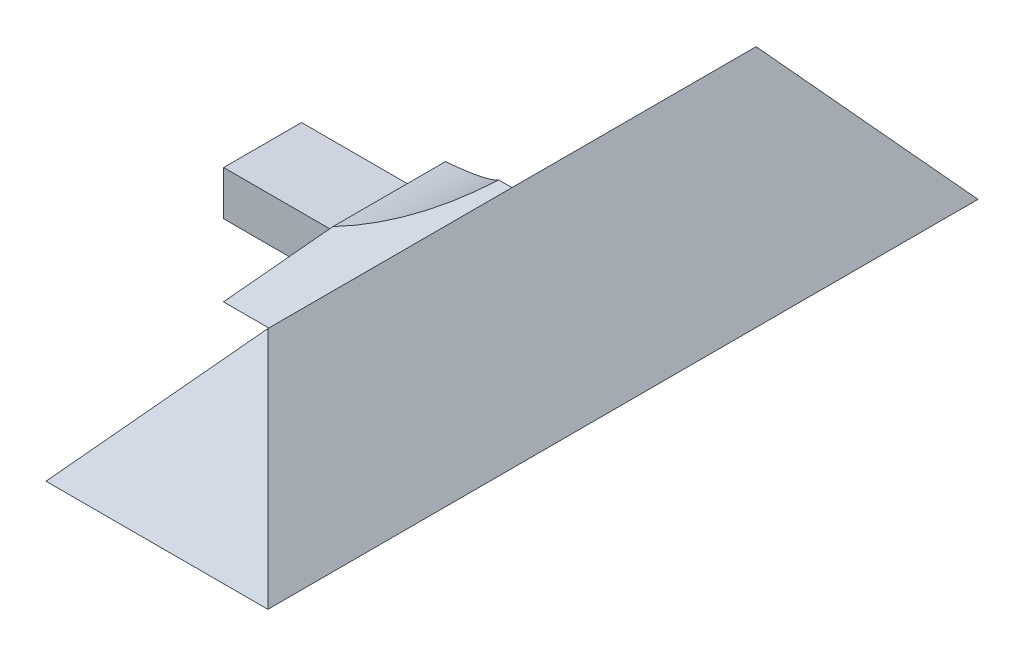
from build123d import *

# Parameters (mm, degrees)
BOSS_EXTRUDE1_START       = -105
BOSS_EXTRUDE1_DEPTH       = 160
BOSS_EXTRUDE1_2_DEPTH     = 40
BOSS_EXTRUDE1_START_2     = -20
BOSS_EXTRUDE1_3_OUTLINE_W = 47
BOSS_EXTRUDE1_3_OUTLINE_H = 147
BOSS_EXTRUDE1_3_DEPTH     = 20
BOSS_EXTRUDE1_START_3     = 42.132444372
BOSS_EXTRUDE1_4_OUTLINE_W = 53
BOSS_EXTRUDE1_4_OUTLINE_H = 116
BOSS_EXTRUDE1_4_DEPTH     = 19.867555628
BOSS_EXTRUDE1_START_4     = 80.434666527
BOSS_EXTRUDE1_5_OUTLINE_W = 52
BOSS_EXTRUDE1_5_OUTLINE_H = 117
BOSS_EXTRUDE1_5_DEPTH     = 20.565333473
SKETCH2_W                 = 32.400830654
SKETCH2_H                 = 17.550449938
BOSS_EXTRUDE2_DEPTH       = 10
SKETCH4_R                 = 75
CUT_EXTRUDE1_DEPTH        = 80


with BuildPart() as part:
    # Boss-Extrude1: read off the stored shape, not the designer's step
    # Boss-Extrude1 outline → Boss-Extrude1 (new body)
    with BuildSketch(Plane.XY.offset(BOSS_EXTRUDE1_START)):
        Polygon((65, 0), (40, 29.793839815), (15, 0), align=None)
    extrude(amount=BOSS_EXTRUDE1_DEPTH)

    # Boss-Extrude1 2 outline → Boss-Extrude1 2 (add)
    with BuildSketch(Plane.YZ):
        Polygon((0, -50), (29.793839815, -25), (0, 0), align=None)
    extrude(amount=BOSS_EXTRUDE1_2_DEPTH)

    # Boss-Extrude1 3 outline → Boss-Extrude1 3 (cut)
    with BuildSketch(Plane(origin=(0, 0, 0), x_dir=(0.6427876096865404, 0.7660444431189772, 0), z_dir=(0.7660444431189772, -0.6427876096865403, 0)).offset(BOSS_EXTRUDE1_START_2)):
        with Locations((22.5, -24.5)):
            Rectangle(BOSS_EXTRUDE1_3_OUTLINE_W, BOSS_EXTRUDE1_3_OUTLINE_H)
    extrude(amount=BOSS_EXTRUDE1_3_DEPTH, mode=Mode.SUBTRACT)

    # Boss-Extrude1 4 outline → Boss-Extrude1 4 (cut)
    with BuildSketch(Plane(origin=(0, 0, 0), x_dir=(1, 0, 0), z_dir=(0, 0.6427876096865403, 0.7660444431189772)).offset(BOSS_EXTRUDE1_START_3)):
        with Locations((40.5, 21)):
            Rectangle(BOSS_EXTRUDE1_4_OUTLINE_W, BOSS_EXTRUDE1_4_OUTLINE_H)
    extrude(amount=BOSS_EXTRUDE1_4_DEPTH, mode=Mode.SUBTRACT)

    # Boss-Extrude1 5 outline → Boss-Extrude1 5 (cut)
    with BuildSketch(Plane(origin=(0, 0, 0), x_dir=(1, 0, 0), z_dir=(0, 0.6427876096865403, -0.7660444431189772)).offset(BOSS_EXTRUDE1_START_4)):
        with Locations((40, 10.5)):
            Rectangle(BOSS_EXTRUDE1_5_OUTLINE_W, BOSS_EXTRUDE1_5_OUTLINE_H)
    extrude(amount=BOSS_EXTRUDE1_5_DEPTH, mode=Mode.SUBTRACT)

    # Sketch2 → Boss-Extrude2 (add)
    with BuildSketch(Plane.XZ):
        with Locations((0, -25)):
            Rectangle(SKETCH2_W, SKETCH2_H)
    extrude(amount=-BOSS_EXTRUDE2_DEPTH)

    # Sketch4 → Cut-Extrude1 (cut, symmetric)
    with BuildSketch(Plane.XY):
        with Locations((-13.767329279, 85)):
            Circle(SKETCH4_R)
    extrude(amount=CUT_EXTRUDE1_DEPTH, both=True, mode=Mode.SUBTRACT)


solid = part.part
